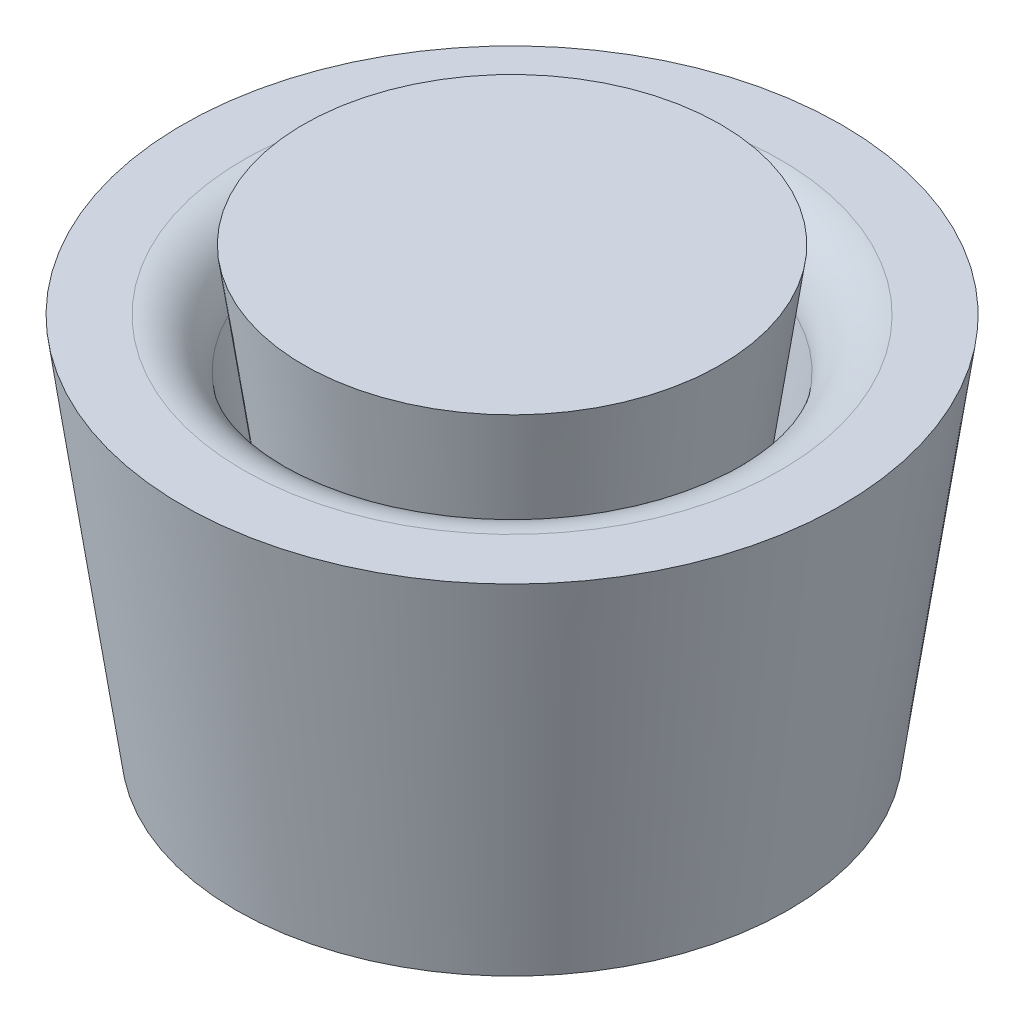
from build123d import *

# Parameters (mm, degrees)
FILLET1_R          = 3
FILLET2_R          = 5
CUT_EXTRUDE1_START = -6.458008592
CUT_EXTRUDE1_DEPTH = 6.458008592
FILLET3_R          = 30


# Read off the part's stored shape, not the designer's step: Cut-Extrude1
with BuildPart() as part:
    # Sketch1 → Revolve1 (revolve)
    with BuildSketch(Plane.XY, mode=Mode.PRIVATE) as revolve1_sk:
        Polygon((8.7, 0), (11.5, 19.803030071), (17.3, 19.803030071), (14.5, 0), (9.5, 0), (9.5, -0.8), (8.7, -0.8), align=None)
        Polygon((0, 23), (10.942081128, 23), (8.114231057, 3), (0, 3), align=None)
    revolve(revolve1_sk.sketch.rotate(Axis((0, 0, 0), (0, 1, 0)), 90), axis=Axis((0, 0, 0), (0, 1, 0)))

    # Fillet1
    fillet1_edges = [part.edges().sort_by_distance(p)[0] for p in [
        (0, 19.803030071, 11.5),
    ]]
    fillet(fillet1_edges, radius=FILLET1_R)

    # Fillet2
    fillet2_edges = [part.edges().sort_by_distance(p)[0] for p in [
        (0, 0, 8.7),
    ]]
    fillet(fillet2_edges, radius=FILLET2_R)

    # Cut-Extrude1 outline → Cut-Extrude1 (cut)
    with BuildSketch(Plane.XZ.offset(0.8).offset(CUT_EXTRUDE1_START)):
        with BuildLine():
            ThreePointArc((6.717514421, 6.717514421), (-9.5, 0), (6.717514421, -6.717514421))
            Line((6.717514421, -6.717514421), (6.151828996, -6.151828996))
            ThreePointArc((6.151828996, -6.151828996), (-8.7, 0), (6.151828996, 6.151828996))
            Line((6.151828996, 6.151828996), (6.717514421, 6.717514421))
        make_face()
    extrude(amount=CUT_EXTRUDE1_DEPTH, mode=Mode.SUBTRACT)

    # Fillet3
    fillet3_edges = [part.edges().sort_by_distance(p)[0] for p in [
        (-8.776855559, 5.658008592, 3.635492607),
    ]]
    fillet(fillet3_edges, radius=FILLET3_R)


solid = part.part
